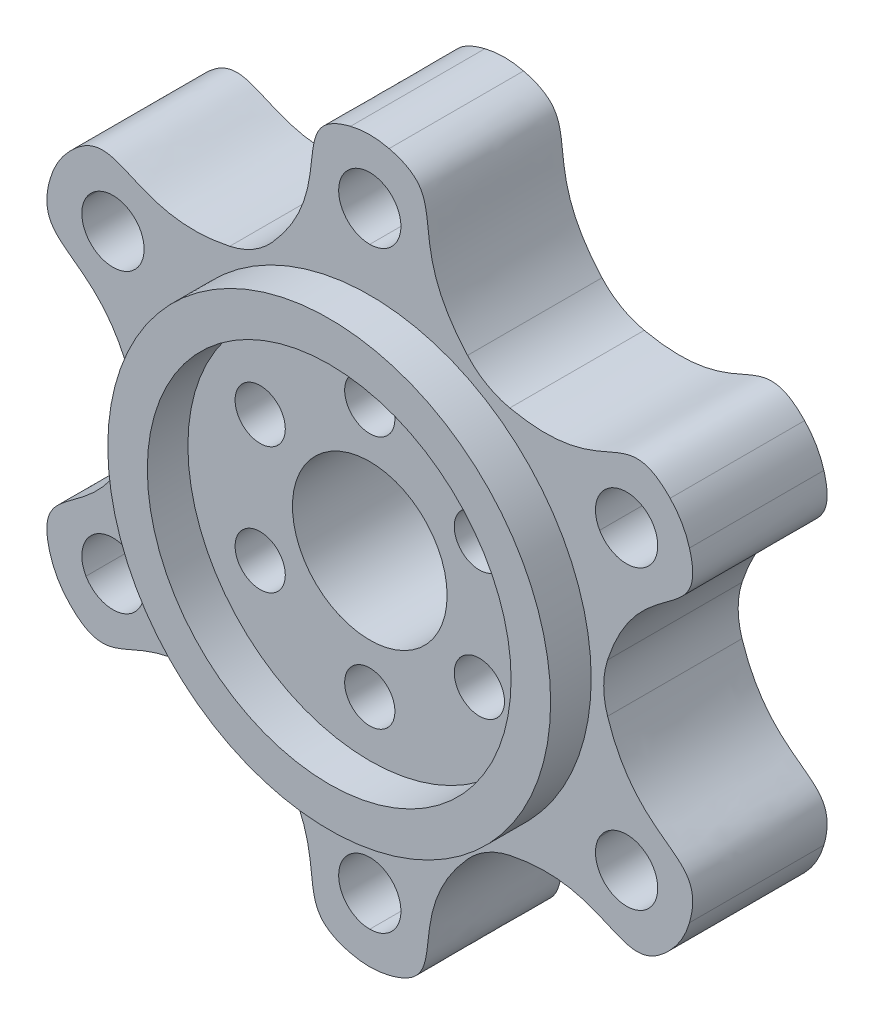
from build123d import *

# Parameters (mm, degrees)
SKETCH1_R           = 45.72
SKETCH1_R_2         = 9.779
SKETCH1_R_3         = 3.175
SKETCH1_R_4         = 3.937
BOSS_EXTRUDE3_DEPTH = 17.000000036
CUT_EXTRUDE1_START  = -22.86
CUT_EXTRUDE1_DEPTH  = 22.86
SKETCH4_R           = 28
SKETCH4_R_2         = 23
BOSS_EXTRUDE4_DEPTH = 5.1308
FILLET1_R           = 10


with BuildPart() as part:
    # Sketch1 → Boss-Extrude3 (new body)
    with BuildSketch(Plane.XY):
        Circle(SKETCH1_R)
        Circle(SKETCH1_R_2, mode=Mode.SUBTRACT)
        with Locations((0, 16.002)):
            Circle(SKETCH1_R_3, mode=Mode.SUBTRACT)
        with Locations((13.858138511, 8.001)):
            Circle(SKETCH1_R_3, mode=Mode.SUBTRACT)
        with Locations((13.858138511, -8.001)):
            Circle(SKETCH1_R_3, mode=Mode.SUBTRACT)
        with Locations((0, -16.002)):
            Circle(SKETCH1_R_3, mode=Mode.SUBTRACT)
        with Locations((-13.858138511, -8.001)):
            Circle(SKETCH1_R_3, mode=Mode.SUBTRACT)
        with Locations((-13.858138511, 8.001)):
            Circle(SKETCH1_R_3, mode=Mode.SUBTRACT)
        with Locations((0, 37.5)):
            Circle(SKETCH1_R_4, mode=Mode.SUBTRACT)
        with Locations((32.475952642, 18.75)):
            Circle(SKETCH1_R_4, mode=Mode.SUBTRACT)
        with Locations((32.475952642, -18.75)):
            Circle(SKETCH1_R_4, mode=Mode.SUBTRACT)
        with Locations((0, -37.5)):
            Circle(SKETCH1_R_4, mode=Mode.SUBTRACT)
        with Locations((-32.475952642, -18.75)):
            Circle(SKETCH1_R_4, mode=Mode.SUBTRACT)
        with Locations((-32.475952642, 18.75)):
            Circle(SKETCH1_R_4, mode=Mode.SUBTRACT)
    extrude(amount=BOSS_EXTRUDE3_DEPTH)

    # Sketch2 → Cut-Extrude1 (cut)
    with BuildSketch(Plane.XY.offset(17.000000036).offset(CUT_EXTRUDE1_START)):
        with BuildLine():
            ThreePointArc((39.594681461, -22.86), (45.72, 0), (39.594681461, 22.86))
            add(Edge.make_bspline(
                [(29.25, 0), (32.932092251, 17.195322725), (44.628878831, 10.61767176), (39.594681461, 22.86)],
                knots=[0, 0, 0, 0, 1, 1, 1, 1], degree=3))
            add(Edge.make_bspline(
                [(29.25, 0), (32.932092251, -17.195322725), (44.628878831, -10.61767176), (39.594681461, -22.86)],
                knots=[0, 0, 0, 0, 1, 1, 1, 1], degree=3))
        make_face()
        with BuildLine():
            add(Edge.make_bspline(
                [(14.625, 25.331243061), (31.357632431, 19.922367126), (31.509612889, 33.34090693), (39.594681461, 22.86)],
                knots=[0, 0, 0, 0, 1, 1, 1, 1], degree=3))
            ThreePointArc((39.594681461, 22.86), (22.86, 39.594681461), (0, 45.72))
            add(Edge.make_bspline(
                [(14.625, 25.331243061), (1.574459819, 37.117689851), (13.119265943, 43.95857869), (0, 45.72)],
                knots=[0, 0, 0, 0, 1, 1, 1, 1], degree=3))
        make_face()
        with BuildLine():
            ThreePointArc((0, -45.72), (22.86, -39.594681461), (39.594681461, -22.86))
            add(Edge.make_bspline(
                [(14.625, -25.331243061), (31.357632431, -19.922367126), (31.509612889, -33.34090693), (39.594681461, -22.86)],
                knots=[0, 0, 0, 0, 1, 1, 1, 1], degree=3))
            add(Edge.make_bspline(
                [(14.625, -25.331243061), (1.574459819, -37.117689851), (13.119265943, -43.95857869), (0, -45.72)],
                knots=[0, 0, 0, 0, 1, 1, 1, 1], degree=3))
        make_face()
        with BuildLine():
            add(Edge.make_bspline(
                [(-14.625, 25.331243061), (-1.574459819, 37.117689851), (-13.119265943, 43.95857869), (0, 45.72)],
                knots=[0, 0, 0, 0, 1, 1, 1, 1], degree=3))
            ThreePointArc((0, 45.72), (-22.86, 39.594681461), (-39.594681461, 22.86))
            add(Edge.make_bspline(
                [(-14.625, 25.331243061), (-31.357632431, 19.922367126), (-31.509612889, 33.34090693), (-39.594681461, 22.86)],
                knots=[0, 0, 0, 0, 1, 1, 1, 1], degree=3))
        make_face()
        with BuildLine():
            ThreePointArc((-39.594681461, -22.86), (-22.86, -39.594681461), (0, -45.72))
            add(Edge.make_bspline(
                [(-14.625, -25.331243061), (-1.574459819, -37.117689851), (-13.119265943, -43.95857869), (0, -45.72)],
                knots=[0, 0, 0, 0, 1, 1, 1, 1], degree=3))
            add(Edge.make_bspline(
                [(-14.625, -25.331243061), (-31.357632431, -19.922367126), (-31.509612889, -33.34090693), (-39.594681461, -22.86)],
                knots=[0, 0, 0, 0, 1, 1, 1, 1], degree=3))
        make_face()
        with BuildLine():
            add(Edge.make_bspline(
                [(-29.25, 0), (-32.932092251, 17.195322725), (-44.628878831, 10.61767176), (-39.594681461, 22.86)],
                knots=[0, 0, 0, 0, 1, 1, 1, 1], degree=3))
            ThreePointArc((-39.594681461, 22.86), (-45.72, 0), (-39.594681461, -22.86))
            add(Edge.make_bspline(
                [(-29.25, 0), (-32.932092251, -17.195322725), (-44.628878831, -10.61767176), (-39.594681461, -22.86)],
                knots=[0, 0, 0, 0, 1, 1, 1, 1], degree=3))
        make_face()
    extrude(amount=CUT_EXTRUDE1_DEPTH, mode=Mode.SUBTRACT)

    # Sketch4 → Boss-Extrude4 (add)
    with BuildSketch(Plane.XY.offset(17.000000036)):
        Circle(SKETCH4_R)
        Circle(SKETCH4_R_2, mode=Mode.SUBTRACT)
    extrude(amount=BOSS_EXTRUDE4_DEPTH)

    # Fillet1
    fillet1_edges = [part.edges().sort_by_distance(p)[0] for p in [
        (29.25, 0, 8.500000018),
        (39.594681461, -22.86, 8.500000018),
        (0, -45.72, 8.500000018),
        (14.625, -25.331243061, 8.500000018),
        (-14.625, -25.331243061, 8.500000018),
        (-39.594681461, -22.86, 8.500000018),
        (-29.25, 0, 8.500000018),
        (-39.594681461, 22.86, 8.500000018),
        (-14.625, 25.331243061, 8.500000018),
        (14.625, 25.331243061, 8.500000018),
        (39.594681461, 22.86, 8.500000018),
        (0, 45.72, 8.500000018),
    ]]
    fillet(fillet1_edges, radius=FILLET1_R)


solid = part.part
